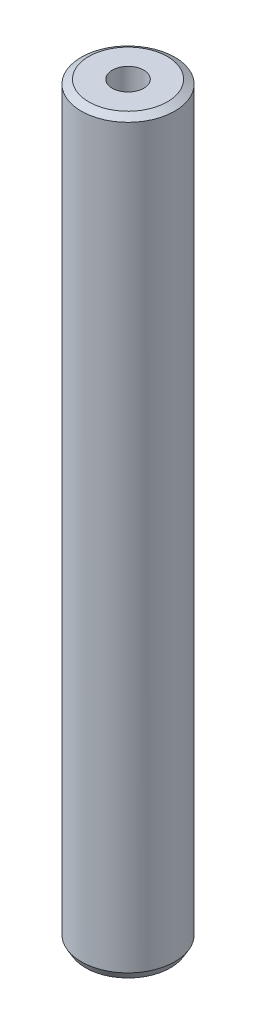
from build123d import *
from OCP.BRepFilletAPI import BRepFilletAPI_MakeChamfer

# Parameters (mm, degrees)
SKETCH1_R           = 37.5
BOSS_EXTRUDE1_DEPTH = 600
SKETCH2_R           = 12.632229014
CUT_EXTRUDE1_DEPTH  = 603.339190158
CHAMFER1_SIZE       = 3.453778301
CHAMFER1_SIZE2      = 5.982119496


with BuildPart() as part:
    # Sketch1 → Boss-Extrude1 (new body)
    with BuildSketch(Plane(origin=(0, 0, 0), x_dir=(1, 0, 0), z_dir=(0, 1, 0))):
        Circle(SKETCH1_R)
    extrude(amount=BOSS_EXTRUDE1_DEPTH)

    # Sketch2 → Cut-Extrude1 (cut, through all)
    with BuildSketch(Plane(origin=(0, 0, 0), x_dir=(1, 0, 0), z_dir=(0, 1, 0))):
        Circle(SKETCH2_R)
    extrude(amount=CUT_EXTRUDE1_DEPTH, mode=Mode.SUBTRACT)

    # Chamfer1: one chamfer whose edges measure the first distance from different faces: ONE call of the kernel's chamfer builder (chamfer() names one face for all edges)
    chamfer1_edges_1 = [part.edges().sort_by_distance(p)[0] for p in [
        (-37.5, 600, 0),
    ]]
    chamfer1_side_1 = [part.faces().sort_by_distance(p)[0] for p in [
        (-37.5, 300, 0),
    ]]
    chamfer1_edges_2 = [part.edges().sort_by_distance(p)[0] for p in [
        (-37.5, 0, 0),
    ]]
    chamfer1_side_2 = [part.faces().sort_by_distance(p)[0] for p in [
        (-36.439339828, 0, 0),
    ]]
    chamfer1 = BRepFilletAPI_MakeChamfer(part.part.solid().wrapped)
    for e in chamfer1_edges_1:
        chamfer1.Add(CHAMFER1_SIZE, CHAMFER1_SIZE2, e.wrapped, chamfer1_side_1[0].wrapped)  # the first distance lies on this face
    for e in chamfer1_edges_2:
        chamfer1.Add(CHAMFER1_SIZE, CHAMFER1_SIZE2, e.wrapped, chamfer1_side_2[0].wrapped)  # the first distance lies on this face
    add(Compound.cast(chamfer1.Shape()), mode=Mode.REPLACE)


solid = part.part
